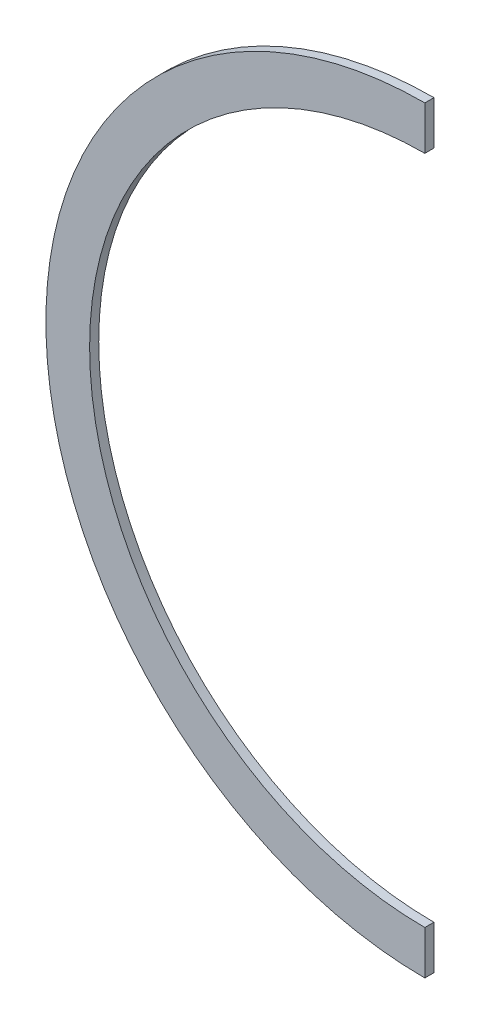
from build123d import *

# Parameters (mm, degrees)
SKETCH2_R           = 116.84
BOSS_EXTRUDE1_DEPTH = 1.5875
SKETCH3_W           = 232.210592103
SKETCH3_H           = 398.954583541
CUT_EXTRUDE1_DEPTH  = 190.3271535


with BuildPart() as part:
    # Sketch2 → Boss-Extrude1 (new, symmetric)
    with BuildSketch(Plane.XY):
        with BuildLine():
            ThreePointArc((-1.651, 128.513680847), (-113.443755652, 64.087482344), (-116.974071472, -64.89271823))
            ThreePointArc((-116.974071472, -64.89271823), (-116.588202689, -65.623039511), (-116.197774242, -66.350933404))
            ThreePointArc((-116.197774242, -66.350933404), (-115.802941233, -67.076116512), (-115.403582459, -67.798817153))
            ThreePointArc((-115.403582459, -67.798817153), (0, -135.636), (115.403582459, -67.798817153))
            ThreePointArc((115.403582459, -67.798817153), (115.802941375, -67.076116254), (116.197774523, -66.350932884))
            ThreePointArc((116.197774523, -66.350932884), (116.588202828, -65.62303925), (116.974071472, -64.89271823))
            ThreePointArc((116.974071472, -64.89271823), (113.443755652, 64.087482344), (1.651, 128.513680847))
            ThreePointArc((1.651, 128.513680847), (0.825516124, 128.521420187), (0, 128.524))
            ThreePointArc((0, 128.524), (-0.825516124, 128.521420187), (-1.651, 128.513680847))
        make_face()
        with Locations((0, -3.556)):
            Circle(SKETCH2_R, mode=Mode.SUBTRACT)
    extrude(amount=BOSS_EXTRUDE1_DEPTH, both=True)

    # Sketch3 → Cut-Extrude1 (cut, through all)
    with BuildSketch(Plane(origin=(0, 0, 0), x_dir=(0, 0, -1), z_dir=(1, 0, 0))):
        with Locations((6.714523145, -6.913261573)):
            Rectangle(SKETCH3_W, SKETCH3_H)
    extrude(amount=CUT_EXTRUDE1_DEPTH, mode=Mode.SUBTRACT)


solid = part.part
